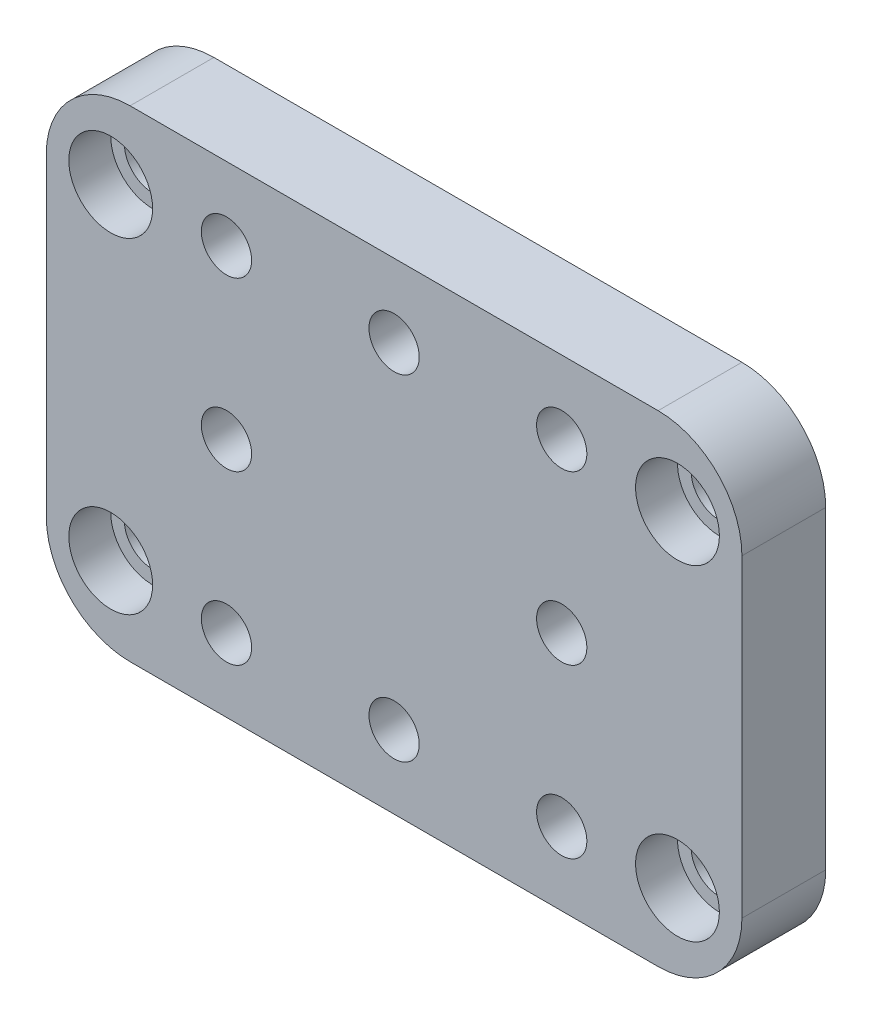
from build123d import *

# Parameters (mm, degrees)
CROQUIS1_W              = 33.201006025
CROQUIS1_H              = 22.978323476
SALIENTE_EXTRUIR1_DEPTH = 4
CROQUIS3_R              = 1.35
CROQUIS3_R_2            = 1.347868192
CROQUIS3_R_3            = 1.352554563
CORTAR_EXTRUIR2_DEPTH   = 41.665750555
REDONDEO2_R             = 4
REDONDEO3_R             = 4
CROQUIS4_R              = 1.2
CORTAR_EXTRUIR3_DEPTH   = 41.665750555
CROQUIS5_R              = 2
CORTAR_EXTRUIR4_DEPTH   = 2


with BuildPart() as part:
    # Croquis1 → Saliente-Extruir1 (new body)
    with BuildSketch(Plane.XY):
        with Locations((16.58985656, 11.664742893)):
            Rectangle(CROQUIS1_W, CROQUIS1_H)
    extrude(amount=SALIENTE_EXTRUIR1_DEPTH)

    # Croquis3 → Cortar-Extruir2 (cut, through all)
    with BuildSketch(Plane(origin=(0, 0, 0), x_dir=(-1, 0, 0), z_dir=(0, 0, -1))):
        with Locations((-30.114791782, 19.441420757)):
            Circle(CROQUIS3_R)
        with Locations((-3.064921335, 19.441420756)):
            Circle(CROQUIS3_R_2)
        with Locations((-3.064921337, 3.888065031)):
            Circle(CROQUIS3_R_3)
        with Locations((-30.114791782, 3.888065031)):
            Circle(CROQUIS3_R)
    extrude(amount=-CORTAR_EXTRUIR2_DEPTH, mode=Mode.SUBTRACT)

    # Redondeo2
    redondeo2_edges = [part.edges().sort_by_distance(p)[0] for p in [
        (33.190359572, 0.175581155, 2),
        (33.190359572, 23.153904631, 2),
    ]]
    fillet(redondeo2_edges, radius=REDONDEO2_R)

    # Redondeo3
    redondeo3_edges = [part.edges().sort_by_distance(p)[0] for p in [
        (-0.010646453, 0.175581155, 2),
        (-0.010646453, 23.153904631, 2),
    ]]
    fillet(redondeo3_edges, radius=REDONDEO3_R)

    # Croquis4 → Cortar-Extruir3 (cut, through all)
    with BuildSketch(Plane.XY.offset(4)):
        with Locations((8.589856559, 19.664742893)):
            Circle(CROQUIS4_R)
        with Locations((16.589856559, 19.664742893)):
            Circle(CROQUIS4_R)
        with Locations((8.589856559, 11.664742893)):
            Circle(CROQUIS4_R)
        with Locations((24.589856559, 19.664742893)):
            Circle(CROQUIS4_R)
        with Locations((8.589856559, 3.664742893)):
            Circle(CROQUIS4_R)
        with Locations((24.589856559, 11.664742893)):
            Circle(CROQUIS4_R)
        with Locations((16.589856559, 3.664742893)):
            Circle(CROQUIS4_R)
        with Locations((24.589856559, 3.664742893)):
            Circle(CROQUIS4_R)
    extrude(amount=-CORTAR_EXTRUIR3_DEPTH, mode=Mode.SUBTRACT)

    # Croquis5 → Cortar-Extruir4 (cut)
    with BuildSketch(Plane.XY.offset(4)):
        with Locations((3.064921335, 19.441420756)):
            Circle(CROQUIS5_R)
        with Locations((30.114791782, 19.441420757)):
            Circle(CROQUIS5_R)
        with Locations((30.114791782, 3.888065031)):
            Circle(CROQUIS5_R)
        with Locations((3.064921337, 3.888065031)):
            Circle(CROQUIS5_R)
    extrude(amount=-CORTAR_EXTRUIR4_DEPTH, mode=Mode.SUBTRACT)


solid = part.part
